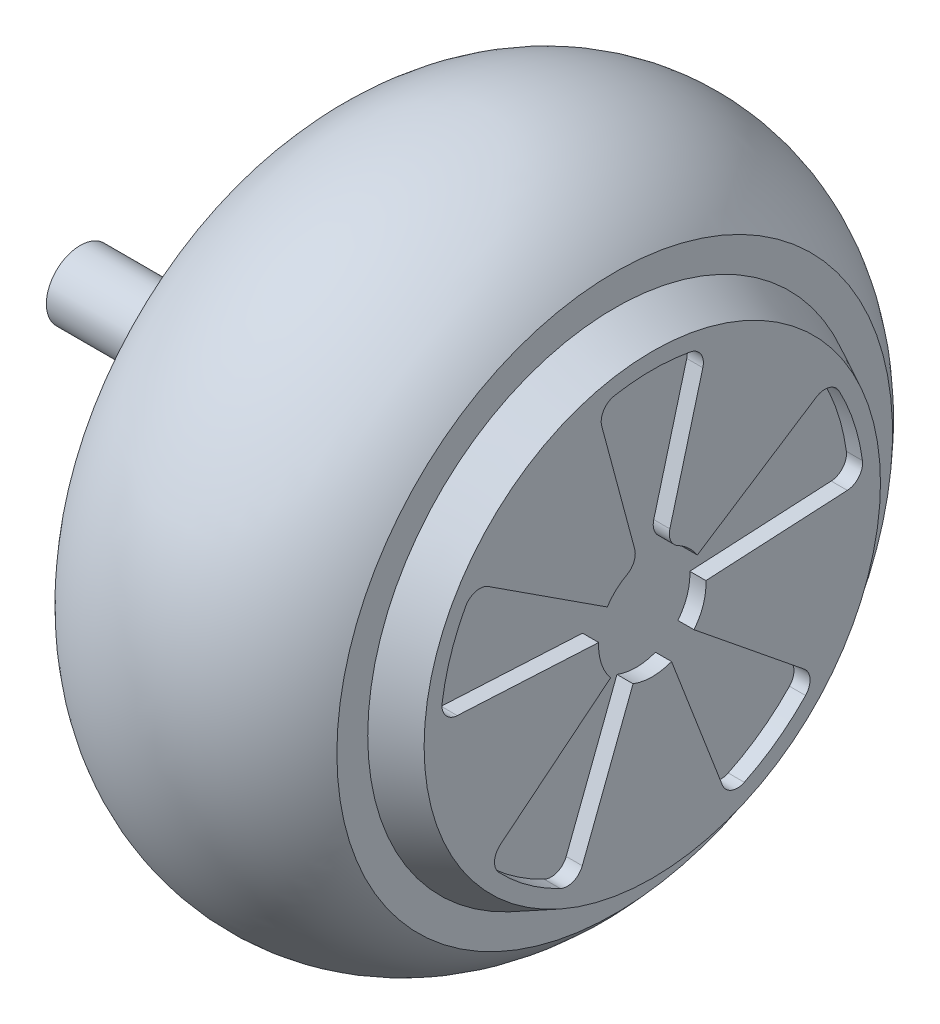
from build123d import *

# Parameters (mm, degrees)
SKETCH3_R           = 60.325
BOSS_EXTRUDE1_DEPTH = 8.89
CHAMFER1_SIZE       = 12.7
CHAMFER1_SIZE_2     = 6.35
CUT_EXTRUDE1_DEPTH  = 3.81
FILLET1_R           = 3.81
CIRPATTERN1_START   = 38.301794875
CIRPATTERN1_DEPTH   = 3.81
SKETCH5_R           = 8
BOSS_EXTRUDE2_DEPTH = 60


# Read off the part's stored shape, not the designer's step: CirPattern1
with BuildPart() as part:
    # Sketch1 → Revolve1 (revolve)
    with BuildSketch(Plane.XZ, mode=Mode.PRIVATE) as revolve1_sk:
        with BuildLine():
            ThreePointArc((-33.221794875, -65.71974362), (0, -81.28), (33.221794875, -65.71974362))
            Line((33.221794875, -65.71974362), (33.221794875, 0))
            Line((33.221794875, 0), (-33.221794875, 0))
            Line((-33.221794875, 0), (-33.221794875, -65.71974362))
        make_face()
    revolve(revolve1_sk.sketch.rotate(Axis((-33.221794875, 0, 0), (1, 0, 0)), 180), axis=Axis((-33.221794875, 0, 0), (1, 0, 0)))

    # Sketch3 → Boss-Extrude1 (add)
    with BuildSketch(Plane(origin=(33.221794875, 0, 0), x_dir=(0, 0, -1), z_dir=(1, 0, 0))):
        with Locations(Location((0, 0, 0), (0, 0, 180))):
            Circle(SKETCH3_R)
    extrude(amount=BOSS_EXTRUDE1_DEPTH)

    # Chamfer1
    # the kernel refuses this chamfer: 12.7, 6.35 mm, written as the material it takes off along each edge
    with BuildSketch(Plane(origin=(42.111794875, 0, 0), x_dir=(0, 0, 1), z_dir=(0, 1, 0))) as chamfer1_piece_1_section:
        Polygon((60.325, -CHAMFER1_SIZE), (60.325 - CHAMFER1_SIZE_2, 0), (60.325, 0), align=None)
    chamfer1_piece_1 = revolve(axis=Axis((42.111794875, 0, 0), (1, 0, 0)), mode=Mode.PRIVATE)
    chamfer1_piece_1 = split(chamfer1_piece_1, bisect_by=Plane(origin=(33.221794875, 0, -56.304392735), z_dir=(1, 0, 0)), keep=Keep.TOP, mode=Mode.PRIVATE)
    add(chamfer1_piece_1, mode=Mode.SUBTRACT)

    # Sketch4 → Cut-Extrude1 (cut)
    with BuildSketch(Plane(origin=(42.111794875, 0, 0), x_dir=(0, 0, -1), z_dir=(1, 0, 0))):
        with BuildLine():
            ThreePointArc((-3.287001873, 12.267257994), (0, -12.7), (3.287001873, 12.267257994))
            Line((3.287001873, 12.267257994), (12.983657398, 48.455669076))
            ThreePointArc((12.983657398, 48.455669076), (0, 50.165), (-12.983657398, 48.455669076))
            Line((-12.983657398, 48.455669076), (-3.287001873, 12.267257994))
        make_face()
    extrude(amount=-CUT_EXTRUDE1_DEPTH, mode=Mode.SUBTRACT)

    # Fillet1
    fillet1_edges = [part.edges().sort_by_distance(p)[0] for p in [
        (40.206794875, 48.455669076, -12.983657398),
        (40.206794875, 12.267257994, 3.287001873),
        (40.206794875, 48.455669076, 12.983657398),
        (40.206794875, 12.267257994, -3.287001873),
    ]]
    fillet(fillet1_edges, radius=FILLET1_R)

    # CirPattern1 outline → CirPattern1 (cut)
    with BuildSketch(Plane.YZ.offset(CIRPATTERN1_START)):
        with BuildLine():
            ThreePointArc((-29.073443692, 35.902712946), (-31.792302862, 37.307304663), (-34.667331707, 36.258838058))
            ThreePointArc((-34.667331707, 36.258838058), (-40.584337523, 29.486247181), (-45.196998855, 21.765994566))
            ThreePointArc((-45.196998855, 21.765994566), (-45.30571708, 18.70768565), (-43.129697286, 16.55593963))
            Line((-43.129697286, 16.55593963), (-11.856471417, 4.551272959))
            ThreePointArc((-11.856471417, 4.551272959), (-10.274515829, 7.464872704), (-7.992368966, 9.869753711))
            Line((-7.992368966, 9.869753711), (-29.073443692, 35.902712946))
        make_face()
        with BuildLine():
            Line((2.417824845, 46.134846353), (0.664666644, 12.682595091))
            ThreePointArc((0.664666644, 12.682595091), (3.924515829, 12.078417757), (6.916915745, 10.651116213))
            Line((6.916915745, 10.651116213), (25.161320914, 38.745036519))
            ThreePointArc((25.161320914, 38.745036519), (25.656993331, 41.764867961), (23.771409561, 44.175188879))
            ThreePointArc((23.771409561, 44.175188879), (15.501837523, 47.70975014), (6.734050225, 49.710962499))
            ThreePointArc((6.734050225, 49.710962499), (3.791829822, 48.869290246), (2.417824845, 46.134846353))
        make_face()
        with BuildLine():
            ThreePointArc((6.916915745, -10.651116213), (3.924515829, -12.078417757), (0.664666644, -12.682595091))
            Line((0.664666644, -12.682595091), (2.417824845, -46.134846353))
            ThreePointArc((2.417824845, -46.134846353), (3.791829822, -48.869290246), (6.734050225, -49.710962499))
            ThreePointArc((6.734050225, -49.710962499), (15.501837523, -47.70975014), (23.771409561, -44.175188879))
            ThreePointArc((23.771409561, -44.175188879), (25.656993331, -41.764867961), (25.161320914, -38.745036519))
            Line((25.161320914, -38.745036519), (6.916915745, -10.651116213))
        make_face()
        with BuildLine():
            ThreePointArc((-7.992368966, -9.869753711), (-10.274515829, -7.464872704), (-11.856471417, -4.551272959))
            Line((-11.856471417, -4.551272959), (-43.129697286, -16.55593963))
            ThreePointArc((-43.129697286, -16.55593963), (-45.30571708, -18.70768565), (-45.196998855, -21.765994566))
            ThreePointArc((-45.196998855, -21.765994566), (-40.584337523, -29.486247181), (-34.667331707, -36.258838058))
            ThreePointArc((-34.667331707, -36.258838058), (-31.792302862, -37.307304663), (-29.073443692, -35.902712946))
            Line((-29.073443692, -35.902712946), (-7.992368966, -9.869753711))
        make_face()
    extrude(amount=CIRPATTERN1_DEPTH, mode=Mode.SUBTRACT)

    # Sketch5 → Boss-Extrude2 (add)
    with BuildSketch(Plane.ZY.offset(33.221794875)):
        with Locations(Location((0, 0, 0), (0, 0, 180))):
            Circle(SKETCH5_R)
    extrude(amount=BOSS_EXTRUDE2_DEPTH)


solid = part.part
